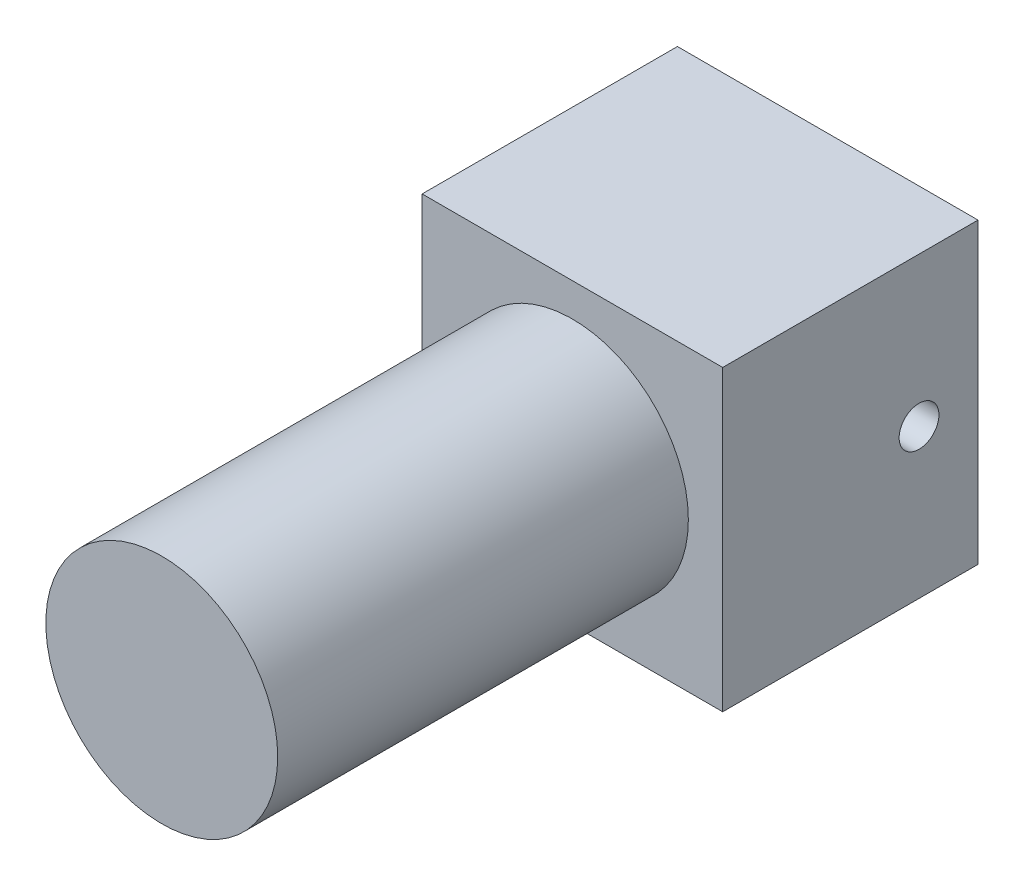
from build123d import *

# Parameters (mm, degrees)
SKETCH1_W           = 38.5
SKETCH1_H           = 38.2
BOSS_EXTRUDE1_DEPTH = 32.7
SKETCH2_R           = 14.85
BOSS_EXTRUDE2_DEPTH = 52.6
SKETCH3_R           = 2.55
CUT_EXTRUDE1_DEPTH  = 7.2136
SKETCH4_R           = 2.06599734
BOSS_EXTRUDE3_DEPTH = 5.08


with BuildPart() as part:
    # Sketch1 → Boss-Extrude1 (new body)
    with BuildSketch(Plane.XY):
        Rectangle(SKETCH1_W, SKETCH1_H)
    extrude(amount=BOSS_EXTRUDE1_DEPTH)

    # Sketch2 → Boss-Extrude2 (add)
    with BuildSketch(Plane.XY.offset(32.7)):
        Circle(SKETCH2_R)
    extrude(amount=BOSS_EXTRUDE2_DEPTH)

    # Sketch3 → Cut-Extrude1 (cut)
    with BuildSketch(Plane(origin=(19.25, 0, 0), x_dir=(0, 0, -1), z_dir=(1, 0, 0))):
        with Locations((-7.554319607, 0)):
            Circle(SKETCH3_R)
    cut_extrude1 = extrude(amount=-CUT_EXTRUDE1_DEPTH, mode=Mode.SUBTRACT)

    # Mirror1: Cut-Extrude1 across plane
    add(cut_extrude1.mirror(Plane(origin=(0, 0, 0), x_dir=(0, 0, 1), z_dir=(1, 0, 0))), mode=Mode.SUBTRACT)

    # Sketch4 → Boss-Extrude3 (add)
    with BuildSketch(Plane(origin=(0, 0, 0), x_dir=(-1, 0, 0), z_dir=(0, 0, -1))):
        with Locations((0, -16.651600327)):
            Circle(SKETCH4_R)
    extrude(amount=BOSS_EXTRUDE3_DEPTH)


solid = part.part
